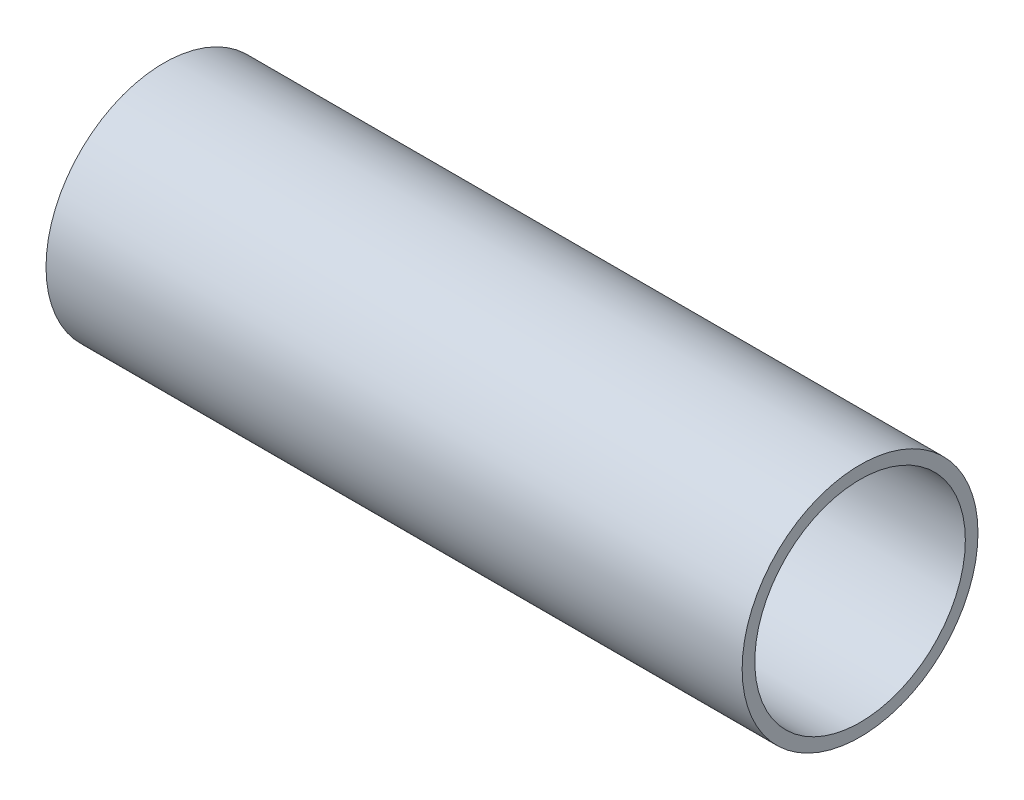
from build123d import *

# Parameters (mm, degrees)
SKETCH2_R           = 93.17284
BOSS_EXTRUDE1_DEPTH = 550
SKETCH3_R           = 83.17284
CUT_EXTRUDE1_DEPTH  = 566.563750807


with BuildPart() as part:
    # Sketch2 → Boss-Extrude1 (new body)
    with BuildSketch(Plane(origin=(0, 0, 0), x_dir=(0, 0, -1), z_dir=(1, 0, 0))):
        Circle(SKETCH2_R)
    extrude(amount=BOSS_EXTRUDE1_DEPTH)

    # Sketch3 → Cut-Extrude1 (cut, through all)
    with BuildSketch(Plane(origin=(550, 0, 0), x_dir=(0, 0, -1), z_dir=(1, 0, 0))):
        Circle(SKETCH3_R)
    extrude(amount=-CUT_EXTRUDE1_DEPTH, mode=Mode.SUBTRACT)


solid = part.part
